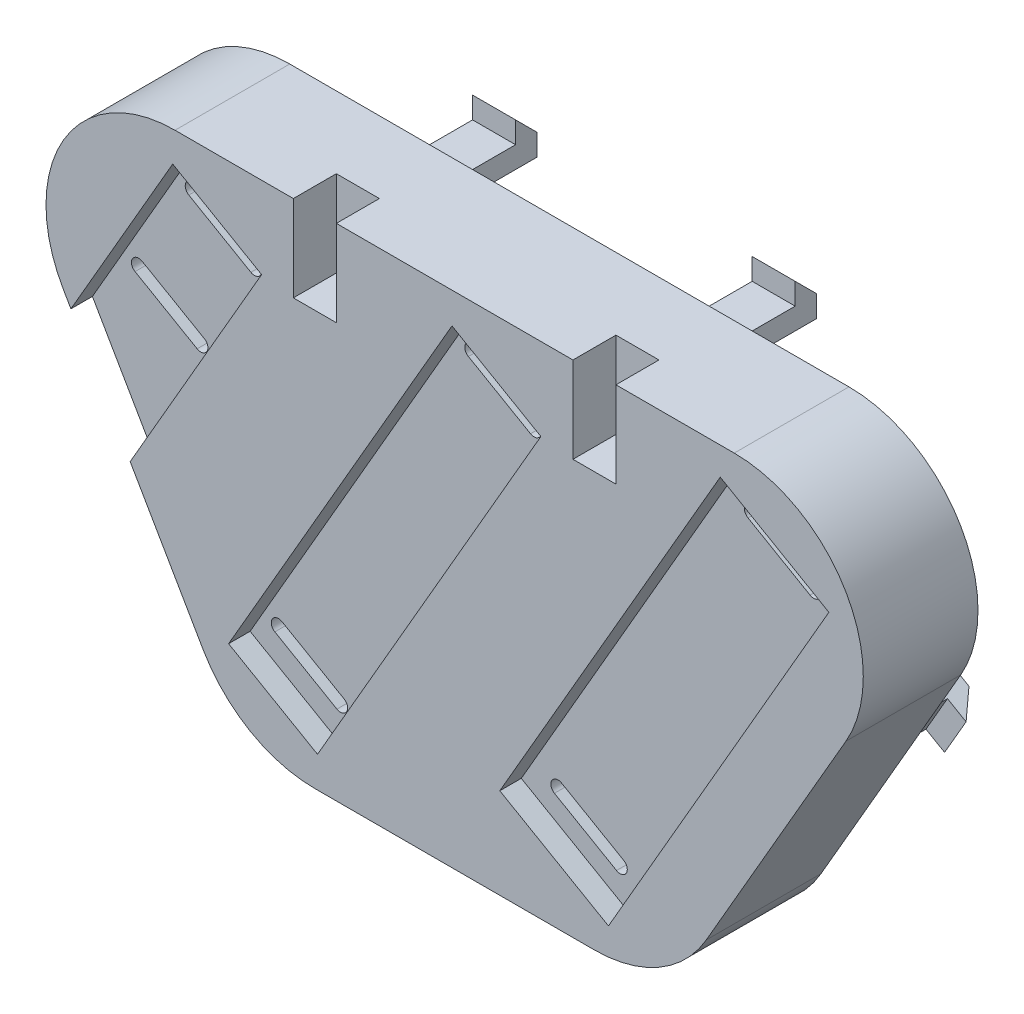
from build123d import *

# Parameters (mm, degrees)
SKETCH1_R           = 7.5
BOSS_EXTRUDE1_DEPTH = 5
BOSS_EXTRUDE2_DEPTH = 1.5
BOSS_EXTRUDE3_DEPTH = 1.5
SKETCH4_W           = 3
SKETCH4_H           = 3
BOSS_EXTRUDE4_DEPTH = 6
CUT_EXTRUDE1_REACH  = 57.939
SKETCH5_W           = 1.5
SKETCH5_H           = 4.5
CUT_EXTRUDE2_REACH  = 50.106
SKETCH7_W           = 4.5
SKETCH7_H           = 1.5
CUT_EXTRUDE3_REACH  = 42.425
SKETCH8_W           = 4.5
SKETCH8_H           = 1.5
SKETCH9_W           = 3
SKETCH9_H           = 6
CUT_EXTRUDE4_DEPTH  = 3


with BuildPart() as part:
    # Sketch1 → Boss-Extrude1 (new body)
    with BuildSketch(Plane.XY):
        with BuildLine():
            Line((7.794228634, -4.5), (-1.955771366, -21.387495374))
            ThreePointArc((-1.955771366, -21.387495374), (-5.25, -24.681724008), (-9.75, -25.887495374))
            Line((-9.75, -25.887495374), (-29.25, -25.887495374))
            ThreePointArc((-29.25, -25.887495374), (-33.75, -24.681724008), (-37.044228634, -21.387495374))
            Line((-37.044228634, -21.387495374), (-46.794228634, -4.5))
            ThreePointArc((-46.794228634, -4.5), (-46.794228634, 4.5), (-39, 9))
            Line((-39, 9), (0, 9))
            ThreePointArc((0, 9), (7.794228634, 4.5), (7.794228634, -4.5))
        make_face()
        with Locations((-29.25, -16.887495374)):
            Circle(SKETCH1_R, mode=Mode.SUBTRACT)
        with Locations((-19.5, 0)):
            Circle(SKETCH1_R, mode=Mode.SUBTRACT)
        Circle(SKETCH1_R, mode=Mode.SUBTRACT)
        with Locations((-9.75, -16.887495374)):
            Circle(SKETCH1_R, mode=Mode.SUBTRACT)
        with Locations((-39, 0)):
            Circle(SKETCH1_R, mode=Mode.SUBTRACT)
    extrude(amount=BOSS_EXTRUDE1_DEPTH)

    # Sketch2 → Boss-Extrude2 (add)
    with BuildSketch(Plane.XY.offset(5)):
        with BuildLine():
            ThreePointArc((-9.75, -25.887495374), (-5.25, -24.681724008), (-1.955771366, -21.387495374))
            Line((-1.955771366, -21.387495374), (7.794228634, -4.5))
            ThreePointArc((7.794228634, -4.5), (7.794228634, 4.5), (0, 9))
            Line((0, 9), (-39, 9))
            ThreePointArc((-39, 9), (-46.794228634, 4.5), (-46.794228634, -4.5))
            Line((-46.794228634, -4.5), (-37.044228634, -21.387495374))
            ThreePointArc((-37.044228634, -21.387495374), (-33.75, -24.681724008), (-29.25, -25.887495374))
            Line((-29.25, -25.887495374), (-9.75, -25.887495374))
        make_face()
        with BuildLine():
            Line((-29.209936491, -21.81810334), (-33.540063509, -19.31810334))
            ThreePointArc((-33.540063509, -19.31810334), (-33.723076211, -18.635090638), (-33.040063509, -18.452077936))
            Line((-33.040063509, -18.452077936), (-28.709936491, -20.952077936))
            ThreePointArc((-28.709936491, -20.952077936), (-28.526923789, -21.635090638), (-29.209936491, -21.81810334))
        make_face(mode=Mode.SUBTRACT)
        with BuildLine():
            Line((-9.709936491, -21.81810334), (-14.040063509, -19.31810334))
            ThreePointArc((-14.040063509, -19.31810334), (-14.223076211, -18.635090638), (-13.540063509, -18.452077936))
            Line((-13.540063509, -18.452077936), (-9.209936491, -20.952077936))
            ThreePointArc((-9.209936491, -20.952077936), (-9.026923789, -21.635090638), (-9.709936491, -21.81810334))
        make_face(mode=Mode.SUBTRACT)
        with BuildLine():
            Line((-35.209936491, 1.564582562), (-39.540063509, 4.064582562))
            ThreePointArc((-39.540063509, 4.064582562), (-39.723076211, 4.747595264), (-39.040063509, 4.930607966))
            Line((-39.040063509, 4.930607966), (-34.709936491, 2.430607966))
            ThreePointArc((-34.709936491, 2.430607966), (-34.526923789, 1.747595264), (-35.209936491, 1.564582562))
        make_face(mode=Mode.SUBTRACT)
        with BuildLine():
            ThreePointArc((-38.459936491, -4.064582562), (-38.276923789, -4.747595264), (-38.959936491, -4.930607966))
            Line((-38.959936491, -4.930607966), (-43.290063509, -2.430607966))
            ThreePointArc((-43.290063509, -2.430607966), (-43.473076211, -1.747595264), (-42.790063509, -1.564582562))
            Line((-42.790063509, -1.564582562), (-38.459936491, -4.064582562))
        make_face(mode=Mode.SUBTRACT)
        with BuildLine():
            Line((-15.709936491, 1.564582562), (-20.040063509, 4.064582562))
            ThreePointArc((-20.040063509, 4.064582562), (-20.223076211, 4.747595264), (-19.540063509, 4.930607966))
            Line((-19.540063509, 4.930607966), (-15.209936491, 2.430607966))
            ThreePointArc((-15.209936491, 2.430607966), (-15.026923789, 1.747595264), (-15.709936491, 1.564582562))
        make_face(mode=Mode.SUBTRACT)
        with BuildLine():
            Line((3.790063509, 1.564582562), (-0.540063509, 4.064582562))
            ThreePointArc((-0.540063509, 4.064582562), (-0.723076211, 4.747595264), (-0.040063509, 4.930607966))
            Line((-0.040063509, 4.930607966), (4.290063509, 2.430607966))
            ThreePointArc((4.290063509, 2.430607966), (4.473076211, 1.747595264), (3.790063509, 1.564582562))
        make_face(mode=Mode.SUBTRACT)
    extrude(amount=BOSS_EXTRUDE2_DEPTH)

    # Sketch3 → Boss-Extrude3 (add)
    with BuildSketch(Plane.XY.offset(6.5)):
        with BuildLine():
            ThreePointArc((-39, 9), (-46.794228634, 4.5), (-46.794228634, -4.5))
            Line((-46.794228634, -4.5), (-46.262741693, -5.420562386))
            Line((-46.262741693, -5.420562386), (-39.162383905, 6.877618054))
            Line((-39.162383905, 6.877618054), (-32.962616095, 3.29818044))
            Line((-32.962616095, 3.29818044), (-42.129563153, -12.579437614))
            Line((-42.129563153, -12.579437614), (-37.044228634, -21.387495374))
            ThreePointArc((-37.044228634, -21.387495374), (-33.75, -24.681724008), (-29.25, -25.887495374))
            Line((-29.25, -25.887495374), (-9.75, -25.887495374))
            ThreePointArc((-9.75, -25.887495374), (-5.25, -24.681724008), (-1.955771366, -21.387495374))
            Line((-1.955771366, -21.387495374), (7.794228634, -4.5))
            ThreePointArc((7.794228634, -4.5), (7.794228634, 4.5), (0, 9))
            Line((0, 9), (-39, 9))
        make_face()
        Polygon((-19.685165098, 6.83815987), (-13.485397288, 3.258722256), (-29.064834902, -23.725655244), (-35.264602712, -20.14621763), align=None, mode=Mode.SUBTRACT)
        Polygon((-0.976361142, 7.058892896), (6.601361142, 2.683892896), (-8.773638858, -23.94638827), (-16.351361142, -19.57138827), align=None, mode=Mode.SUBTRACT)
    extrude(amount=BOSS_EXTRUDE3_DEPTH)

    # Sketch4 → Boss-Extrude4 (add)
    with BuildSketch(Plane(origin=(0, 0, 0), x_dir=(-1, 0, 0), z_dir=(0, 0, -1))):
        with Locations((19.5, -24.387495374)):
            Rectangle(SKETCH4_W, SKETCH4_H)
        with Locations((29.25, 7.5)):
            Rectangle(SKETCH4_W, SKETCH4_H)
        with Locations((9.75, 7.5)):
            Rectangle(SKETCH4_W, SKETCH4_H)
        Polygon((41.169228634, -14.242785793), (42.669228634, -11.644709581), (40.071152423, -10.144709581), (38.571152423, -12.742785793), align=None)
        Polygon((-3.669228634, -11.644709581), (-2.169228634, -14.242785793), (0.428847577, -12.742785793), (-1.071152423, -10.144709581), align=None)
    extrude(amount=BOSS_EXTRUDE4_DEPTH)

    # Sketch5 → Cut-Extrude1 (cut, up to next)
    with BuildSketch(Plane(origin=(-5.625, 9.742785793, 0), x_dir=(0.8660254037844386, 0.5000000000000001, 0), z_dir=(-0.5000000000000001, 0.8660254037844386, 0)), mode=Mode.PRIVATE) as cut_extrude1_sk1:
        with Locations((-42.024990748, 2.25)):
            Rectangle(SKETCH5_W, SKETCH5_H)
    cut_extrude1_tool1 = extrude(cut_extrude1_sk1.sketch, amount=-CUT_EXTRUDE1_REACH, mode=Mode.PRIVATE) & part.part
    # Sketch5 → Cut-Extrude1 (cut, up to next)
    with BuildSketch(Plane(origin=(-5.625, 9.742785793, 0), x_dir=(0.8660254037844386, 0.5000000000000001, 0), z_dir=(-0.5000000000000001, 0.8660254037844386, 0)), mode=Mode.PRIVATE) as cut_extrude1_sk2:
        Polygon((-42.774990748, 6), (-42.774990748, 4.5), (-41.274990748, 6), align=None)
    cut_extrude1_tool2 = extrude(cut_extrude1_sk2.sketch, amount=-CUT_EXTRUDE1_REACH, mode=Mode.PRIVATE) & part.part
    cut_extrude1_1 = cut_extrude1_tool1.solids().sort_by_distance((-42.01971, -11.26971, -2.25))[0]
    add(cut_extrude1_1, mode=Mode.SUBTRACT)
    cut_extrude1_2 = cut_extrude1_tool2.solids().sort_by_distance((-42.236216, -11.39471, -5.5))[0]
    add(cut_extrude1_2, mode=Mode.SUBTRACT)
    cut_extrude1 = cut_extrude1_1 + cut_extrude1_2  # Cut-Extrude1 as one shape, for the pattern or mirror that repeats it

    # Sketch7 → Cut-Extrude2 (cut, up to next)
    with BuildSketch(Plane.ZY.offset(30.75), mode=Mode.PRIVATE) as cut_extrude2_sk1:
        with Locations((-2.25, 8.25)):
            Rectangle(SKETCH7_W, SKETCH7_H)
    cut_extrude2_tool1 = extrude(cut_extrude2_sk1.sketch, amount=-CUT_EXTRUDE2_REACH, mode=Mode.PRIVATE) & part.part
    # Sketch7 → Cut-Extrude2 (cut, up to next)
    with BuildSketch(Plane.ZY.offset(30.75), mode=Mode.PRIVATE) as cut_extrude2_sk2:
        Polygon((-6, 7.5), (-4.5, 9), (-6, 9), align=None)
    cut_extrude2_tool2 = extrude(cut_extrude2_sk2.sketch, amount=-CUT_EXTRUDE2_REACH, mode=Mode.PRIVATE) & part.part
    cut_extrude2_1 = cut_extrude2_tool1.solids().sort_by_distance((-30.75, 8.25, -2.25))[0]
    add(cut_extrude2_1, mode=Mode.SUBTRACT)
    cut_extrude2_2 = cut_extrude2_tool2.solids().sort_by_distance((-30.75, 8.5, -5.5))[0]
    add(cut_extrude2_2, mode=Mode.SUBTRACT)
    cut_extrude2 = cut_extrude2_1 + cut_extrude2_2  # Cut-Extrude2 as one shape, for the pattern or mirror that repeats it

    # Mirror1: Cut-Extrude1, Cut-Extrude2 across plane
    add(cut_extrude1.mirror(Plane.ZY.offset(19.5)), mode=Mode.SUBTRACT)
    add(cut_extrude2.mirror(Plane.ZY.offset(19.5)), mode=Mode.SUBTRACT)

    # Sketch8 → Cut-Extrude3 (cut, up to next)
    with BuildSketch(Plane.ZY.offset(21), mode=Mode.PRIVATE) as cut_extrude3_sk1:
        Polygon((-6, -25.887495374), (-4.5, -25.887495374), (-6, -24.387495374), align=None)
    cut_extrude3_tool1 = extrude(cut_extrude3_sk1.sketch, amount=-CUT_EXTRUDE3_REACH, mode=Mode.PRIVATE) & part.part
    # Sketch8 → Cut-Extrude3 (cut, up to next)
    with BuildSketch(Plane.ZY.offset(21), mode=Mode.PRIVATE) as cut_extrude3_sk2:
        with Locations((-2.25, -25.137495374)):
            Rectangle(SKETCH8_W, SKETCH8_H)
    cut_extrude3_tool2 = extrude(cut_extrude3_sk2.sketch, amount=-CUT_EXTRUDE3_REACH, mode=Mode.PRIVATE) & part.part
    add(cut_extrude3_tool1.solids().sort_by_distance((-21, -25.387495, -5.5))[0], mode=Mode.SUBTRACT)
    add(cut_extrude3_tool2.solids().sort_by_distance((-21, -25.137495, -2.25))[0], mode=Mode.SUBTRACT)

    # Sketch9 → Cut-Extrude4 (cut)
    with BuildSketch(Plane.XY.offset(8)):
        with Locations((-29.25, 6)):
            Rectangle(SKETCH9_W, SKETCH9_H)
        with Locations((-9.75, 6)):
            Rectangle(SKETCH9_W, SKETCH9_H)
    extrude(amount=-CUT_EXTRUDE4_DEPTH, mode=Mode.SUBTRACT)


solid = part.part
